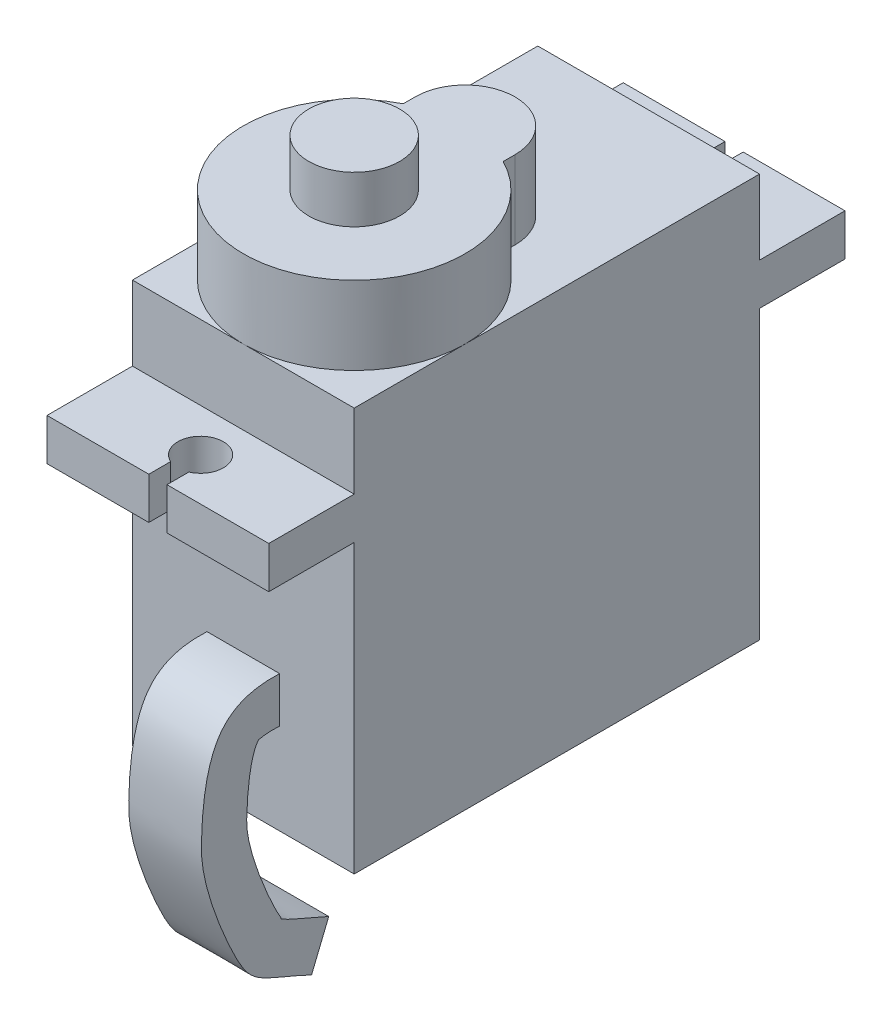
from build123d import *

# Parameters (mm, degrees)
EXTRUDE_1_DEPTH     = 6.1
EXTRUDE_2_DEPTH     = 4.3
SKETCH_3_R          = 2.5
EXTRUDE_3_DEPTH     = 2.6
SWEEP_START         = -2
SWEEP_1_DEPTH       = 4
CUT_EXTRUDE_1_DEPTH = 3


# Read off the part's stored shape, not the designer's step: По траектории1
with BuildPart() as part:
    # Эскиз1 → Бобышка-Вытянуть1 (new, symmetric)
    with BuildSketch(Plane(origin=(0, 0, 0), x_dir=(0, 0, -1), z_dir=(1, 0, 0))):
        Polygon((0, 0), (22.3, 0), (22.3, 15.8), (27, 15.8), (27, 18.1), (22.3, 18.1), (22.3, 22.2), (0, 22.2), (0, 18.1), (-4.7, 18.1), (-4.7, 15.8), (0, 15.8), align=None)
    extrude(amount=EXTRUDE_1_DEPTH, both=True)

    # Эскиз2 → Бобышка-Вытянуть2 (add)
    with BuildSketch(Plane(origin=(0, 22.2, 0), x_dir=(1, 0, 0), z_dir=(0, 1, 0))):
        with BuildLine():
            Line((-2.75, 12.2), (-2.75, 11.54495179))
            ThreePointArc((-2.75, 11.54495179), (0, 0), (2.75, 11.54495179))
            Line((2.75, 11.54495179), (2.75, 12.2))
            ThreePointArc((2.75, 12.2), (0, 14.95), (-2.75, 12.2))
        make_face()
    extrude(amount=EXTRUDE_2_DEPTH)

    # Эскиз3 → Бобышка-Вытянуть3 (add)
    with BuildSketch(Plane(origin=(0, 26.5, 0), x_dir=(1, 0, 0), z_dir=(0, 1, 0))):
        with Locations(Location((0, 6.1, 0), (0, 0, 270))):
            Circle(SKETCH_3_R)
    extrude(amount=EXTRUDE_3_DEPTH)

    # По траектории1 outline → По траектории1 (add)
    with BuildSketch(Plane.YZ.offset(SWEEP_START)):
        with BuildLine():
            Line((5, 0), (7.5, 0))
            add(Edge.make_bspline(
                [(7.5, 0), (7.514192918, 0.283189702), (7.51179741, 0.829450108), (7.398896855, 1.582580851), (7.180233672, 2.201879775), (6.877752257, 2.699325637), (6.580935723, 3.023321902), (6.297244134, 3.252786911), (5.98309658, 3.46040817), (5.288336817, 3.804081146), (4.039026464, 4.131005473), (2.713576748, 4.26284319), (1.607428087, 4.307943756), (1.044549891, 4.310580763), (-0.012369043, 4.192651912), (-1.475987443, 3.8280175), (-3.31312267, 3.123719039), (-4.241412385, 2.700033617), (-4.852907855, 2.403723637), (-5.363854312, 2.136236371), (-5.905808572, 1.760404294), (-6.423173015, 1.209676014), (-6.843296994, 0.315853915), (-7.34377245, -0.92223482), (-7.734653463, -1.754271303)],
                knots=[0, 0, 0, 0, 0.041666667, 0.083333333, 0.125, 0.15625, 0.1875, 0.202710092, 0.21875, 0.25, 0.325, 0.4, 0.422507911, 0.46945254, 0.475, 0.55, 0.625, 0.671875, 0.672156379, 0.71875, 0.765625, 0.8125, 0.90625, 1, 1, 1, 1], degree=3))
            Line((-7.734653463, -1.754271303), (-5.42039044, -2.699885741))
            add(Edge.make_bspline(
                [(5, 0), (5.016742353, 0.186840415), (5.019445718, 0.540402246), (4.983844994, 0.880576602), (4.946974619, 1.037124035), (4.940493488, 1.093513848), (4.941087425, 1.122887176), (4.924410362, 1.159974741), (4.873067413, 1.211551726), (4.608490707, 1.377304764), (3.786081828, 1.638807925), (2.611015642, 1.760430263), (1.749513597, 1.810846664), (1.345595349, 1.826100274), (0.567862631, 1.754949464), (-0.545431357, 1.49761272), (-2.239942452, 0.865505718), (-3.081702835, 0.485020915), (-3.606993361, 0.235472441), (-4.011795584, 0.028497503), (-4.206727511, -0.104384072), (-4.184735153, -0.012747846), (-4.456920638, -0.418551951), (-5.00547165, -1.797446401), (-5.42039044, -2.699885741)],
                knots=[0, 0, 0, 0, 0.041666667, 0.083333333, 0.125, 0.15625, 0.1875, 0.202710092, 0.21875, 0.25, 0.325, 0.4, 0.422507911, 0.46945254, 0.475, 0.55, 0.625, 0.671875, 0.672156379, 0.71875, 0.765625, 0.8125, 0.90625, 1, 1, 1, 1], degree=3))
        make_face()
    extrude(amount=SWEEP_1_DEPTH)

    # Эскиз6 → Вырез-Вытянуть1 (cut)
    with BuildSketch(Plane(origin=(0, 18.1, 0), x_dir=(1, 0, 0), z_dir=(0, 1, 0))):
        with BuildLine():
            Line((-0.5, 27), (-0.5, 25.795643924))
            ThreePointArc((-0.5, 25.795643924), (0, 23.4), (0.5, 25.795643924))
            Line((0.5, 25.795643924), (0.5, 27))
            Line((0.5, 27), (0, 27))
            Line((0, 27), (-0.5, 27))
        make_face()
        with BuildLine():
            Line((0.5, -4.7), (0.5, -3.495643924))
            ThreePointArc((0.5, -3.495643924), (0, -1.1), (-0.5, -3.495643924))
            Line((-0.5, -3.495643924), (-0.5, -4.7))
            Line((-0.5, -4.7), (0, -4.7))
            Line((0, -4.7), (0.5, -4.7))
        make_face()
    extrude(amount=-CUT_EXTRUDE_1_DEPTH, mode=Mode.SUBTRACT)


solid = part.part
